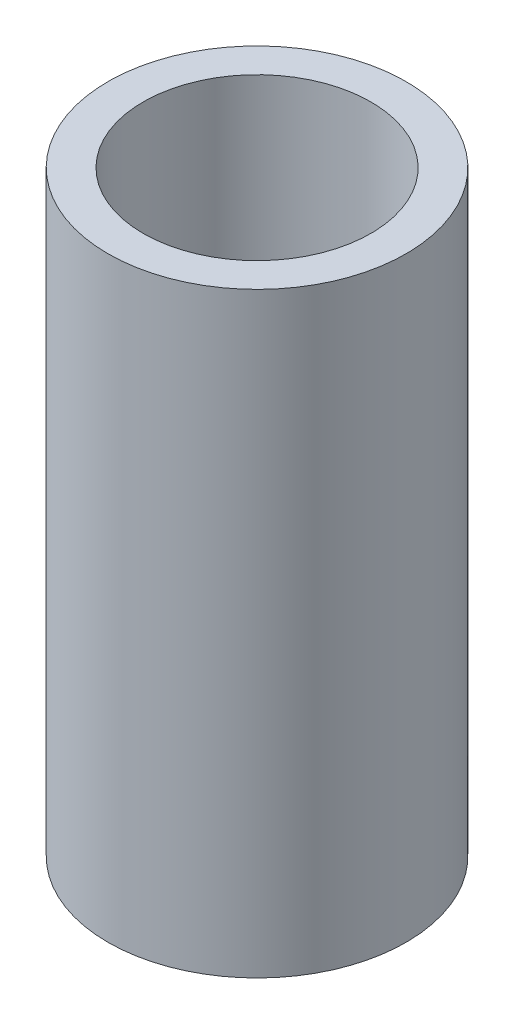
from build123d import *

# Parameters (mm, degrees)
SKETCH1_R      = 57.15
SKETCH1_R_2    = 43.6626
EXTRUDE1_DEPTH = 228.6


with BuildPart() as part:
    # Sketch1 → Extrude1 (new body)
    with BuildSketch(Plane(origin=(0, 0, 0), x_dir=(1, 0, 0), z_dir=(0, 1, 0))):
        Circle(SKETCH1_R)
        Circle(SKETCH1_R_2, mode=Mode.SUBTRACT)
    extrude(amount=EXTRUDE1_DEPTH)


solid = part.part
